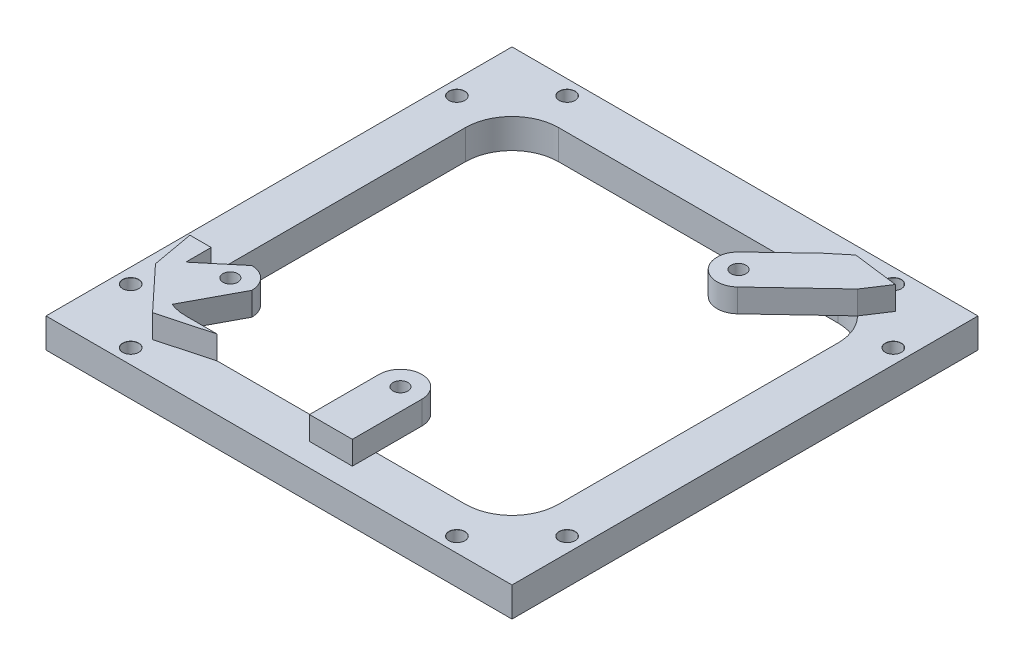
from build123d import *

# Parameters (mm, degrees)
SKETCH1_W                      = 100
SKETCH1_H                      = 100
BOSS_EXTRUDE3_DEPTH            = 6.35
M3_CLEARANCE_HOLE1_D           = 3.4
M3_CLEARANCE_HOLE1_CSINK_D     = 3.45
M3_CLEARANCE_HOLE1_CSINK_ANGLE = 90
CUT_EXTRUDE1_DEPTH             = 10
BOSS_EXTRUDE4_START            = -5
SKETCH20_R                     = 1.6
BOSS_EXTRUDE4_DEPTH            = 5


with BuildPart() as part:
    # Sketch1 → Boss-Extrude3 (new body)
    with BuildSketch(Plane(origin=(0, 0, 0), x_dir=(1, 0, 0), z_dir=(0, 1, 0))):
        Rectangle(SKETCH1_W, SKETCH1_H)
    extrude(amount=BOSS_EXTRUDE3_DEPTH)

    # M3 Clearance Hole1 (through all)
    with Locations(Plane(origin=(0, 6.35, 0), x_dir=(1, 0, 0), z_dir=(0, 1, 0))):
        with Locations((-46.825, 35), (-35, 46.825), (35, 46.825), (46.825, 35), (46.825, -35), (35, -46.825), (-35, -46.825), (-46.825, -35)):
            CounterSinkHole(M3_CLEARANCE_HOLE1_D / 2, M3_CLEARANCE_HOLE1_CSINK_D / 2, counter_sink_angle=M3_CLEARANCE_HOLE1_CSINK_ANGLE)

    # Sketch19 → Cut-Extrude1 (cut)
    with BuildSketch(Plane(origin=(0, 6.35, 0), x_dir=(1, 0, 0), z_dir=(0, 1, 0))):
        with BuildLine():
            Line((-30, -40), (30, -40))
            ThreePointArc((30, -40), (37.071067812, -37.071067812), (40, -30))
            Line((40, -30), (40, 30))
            ThreePointArc((40, 30), (37.071067812, 37.071067812), (30, 40))
            Line((30, 40), (-30, 40))
            ThreePointArc((-30, 40), (-37.071067812, 37.071067812), (-40, 30))
            Line((-40, 30), (-40, -30))
            ThreePointArc((-40, -30), (-37.071067812, -37.071067812), (-30, -40))
        make_face()
    extrude(amount=-CUT_EXTRUDE1_DEPTH, mode=Mode.SUBTRACT)

    # Sketch20 → Boss-Extrude4 (add)
    # profile 1 of 3: a face of its own
    with BuildSketch(Plane(origin=(0, 6.35, -6.35), x_dir=(1, 0, 0), z_dir=(0, -1, 0)).offset(BOSS_EXTRUDE4_START)):
        with BuildLine():
            Line((1.60040755, 51.405773539), (1.60040755, 36.488159347))
            ThreePointArc((1.60040755, 36.488159347), (6.20040755, 31.888159347), (10.80040755, 36.488159347))
            Line((10.80040755, 36.488159347), (10.80040755, 51.405773539))
            Line((10.80040755, 51.405773539), (1.60040755, 51.405773539))
        make_face()
        with Locations((6.20040755, 36.488159347)):
            Circle(SKETCH20_R, mode=Mode.SUBTRACT)
    # profile 2 of 3: a face of its own
    with BuildSketch(Plane(origin=(0, 6.35, -6.35), x_dir=(1, 0, 0), z_dir=(0, -1, 0)).offset(BOSS_EXTRUDE4_START)):
        with BuildLine():
            Line((-40, 36.35), (-32.278050109, 29.911218222))
            ThreePointArc((-32.278050109, 29.911218222), (-29.025358915, 31.258527029), (-27.678050109, 34.511218222))
            Line((-27.678050109, 34.511218222), (-33.625870699, 45.669499004))
            ThreePointArc((-33.625870699, 45.669499004), (-31.844588025, 46.178402465), (-30, 46.35))
            Line((-30, 46.35), (-23.284966027, 46.35))
            Line((-23.284966027, 46.35), (-34.16753953, 49.317235227))
            Line((-34.16753953, 49.317235227), (-42.949209296, 39.905079906))
            Line((-42.949209296, 39.905079906), (-44.562506172, 30.904978845))
            Line((-44.562506172, 30.904978845), (-40, 30.904978845))
            Line((-40, 30.904978845), (-40, 36.35))
        make_face()
        with Locations((-32.278050109, 34.511218222)):
            Circle(SKETCH20_R, mode=Mode.SUBTRACT)
    # profile 3 of 3: a face of its own
    with BuildSketch(Plane(origin=(0, 6.35, -6.35), x_dir=(1, 0, 0), z_dir=(0, -1, 0)).offset(BOSS_EXTRUDE4_START)):
        with BuildLine():
            Line((37.071067812, -30.721067812), (23.825924811, -18.239263593))
            ThreePointArc((23.825924811, -18.239263593), (17.329350004, -18.425900818), (17.503754806, -24.92281552))
            Line((17.503754806, -24.92281552), (26.695067206, -33.65))
            Line((26.695067206, -33.65), (30.564708642, -36.851704553))
            Line((30.564708642, -36.851704553), (40.293422294, -35.621786908))
            Line((40.293422294, -35.621786908), (37.071067812, -30.721067812))
        make_face()
        with Locations((20.671131891, -21.586991424)):
            Circle(SKETCH20_R, mode=Mode.SUBTRACT)
    extrude(amount=BOSS_EXTRUDE4_DEPTH)


solid = part.part
